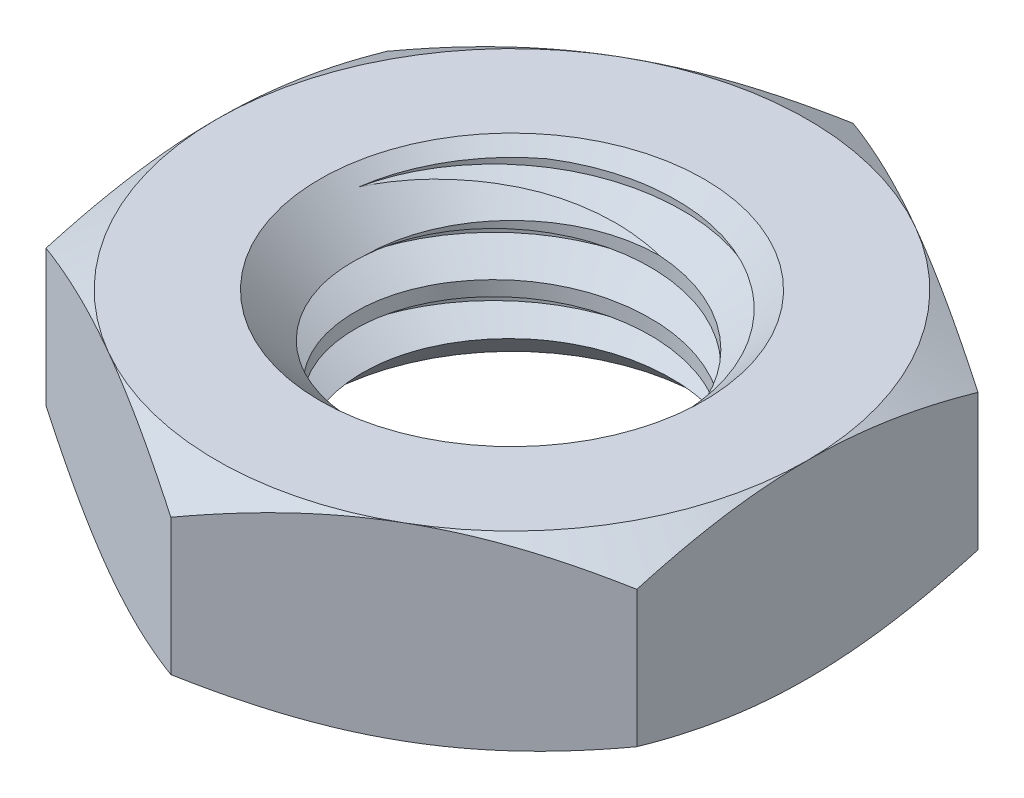
from build123d import *

# Parameters (mm, degrees)
SKETCH2_R           = 2.5
BOSS_EXTRUDE1_DEPTH = 3.2
CHAMFER1_SIZE       = 0.75
THREAD1_PITCH       = 1


with BuildPart() as part:
    # Sketch2 → Boss-Extrude1 (new body)
    with BuildSketch(Plane(origin=(0, 0, 0), x_dir=(1, 0, 0), z_dir=(0, 1, 0))):
        Polygon((5, 2.886751346), (5, -2.886751346), (0, -5.773502692), (-5, -2.886751346), (-5, 2.886751346), (0, 5.773502692), align=None)
        with Locations(Location((0, 0, 0), (0, 0, 270))):
            Circle(SKETCH2_R, mode=Mode.SUBTRACT)
    extrude(amount=BOSS_EXTRUDE1_DEPTH)

    # Sketch4 → Cut-Revolve2 (revolve, cut)
    with BuildSketch(Plane.XY):
        Polygon((-6, 2.622649731), (0, 6.086751346), (0, 7.2), (-6, 7.2), align=None)
        Polygon((-6, 0.577350269), (-6, -4), (0, -4), (0, -2.886751346), align=None)
    revolve(axis=Axis((0, 6.086751346, 0), (0, -1, 0)), mode=Mode.SUBTRACT)

    # Chamfer1
    chamfer1_edges = [part.edges().sort_by_distance(p)[0] for p in [
        (0, 0, -2.5),
        (0, 3.2, -2.5),
    ]]
    chamfer(chamfer1_edges, length=CHAMFER1_SIZE)

    # Thread1: the profile of Thread Profile1 profile screwed along a right-hand helix of 4.45 turns, 8 arcs to a turn; built about Z, then put on its axis
    thread1_z = Axis((0, 0, 0), (0, 0, 1))
    thread1_corners = [(2.4997, 0, -0.000173205), (3.041265875, 0, 0.312499999), (3.041265875, 0, 0.437499999), (2.4997, 0, 0.750173202)]
    with BuildLine(mode=Mode.PRIVATE) as thread1_profile:
        Line(thread1_corners[0], thread1_corners[1])
        Line(thread1_corners[1], thread1_corners[2])
        Line(thread1_corners[2], thread1_corners[3])
        Line(thread1_corners[3], thread1_corners[0])
    thread1_cap = Face(thread1_profile.wire())
    thread1_turn_angles = [0, 22.5, 45, 67.5, 90, 112.5, 135, 157.5, 180, 202.5, 225, 247.5, 270, 292.5, 315, 337.5, 360]
    thread1_turn_weights = [1, 0.9238795325112867, 1, 0.9238795325112867, 1, 0.9238795325112867, 1, 0.9238795325112867, 1, 0.9238795325112867, 1, 0.9238795325112867, 1, 0.9238795325112867, 1, 0.9238795325112867, 1]
    thread1_turn_rails = [Edge.make_bspline([Vector(p[0], p[1], 0).rotate(thread1_z, thread1_turn_angles[k]) / thread1_turn_weights[k] + Vector(0, 0, p[2] + THREAD1_PITCH * thread1_turn_angles[k] / 360) for k in range(17)], [0, 0, 0, 1, 1, 2, 2, 3, 3, 4, 4, 5, 5, 6, 6, 7, 7, 8, 8, 8], 2, thread1_turn_weights) for p in thread1_corners]
    thread1_turn_sides = [Face.make_surface_from_curves(thread1_turn_rails[p[0]], thread1_turn_rails[p[1]]) for p in [(0, 1), (1, 2), (2, 3), (3, 0)]]
    thread1_last_angles = [1440, 1462.5, 1485, 1507.5, 1530, 1552.5, 1575, 1588.5, 1602]
    thread1_last_weights = [1, 0.9238795325112867, 1, 0.9238795325112867, 1, 0.9238795325112867, 1, 0.9723699203976748, 1]
    thread1_last_rails = [Edge.make_bspline([Vector(p[0], p[1], 0).rotate(thread1_z, thread1_last_angles[k]) / thread1_last_weights[k] + Vector(0, 0, p[2] + THREAD1_PITCH * thread1_last_angles[k] / 360) for k in range(9)], [0, 0, 0, 1, 1, 2, 2, 3, 3, 4, 4, 4], 2, thread1_last_weights) for p in thread1_corners]
    thread1_last_sides = [Face.make_surface_from_curves(thread1_last_rails[p[0]], thread1_last_rails[p[1]]) for p in [(0, 1), (1, 2), (2, 3), (3, 0)]]
    thread1 = Plane(origin=(0, 4.45, 0), x_dir=(-1, 0, 0), z_dir=(0, -1, 0)) * Solid(Shell([*[p.moved(Location((0, 0, THREAD1_PITCH * i))) for i in range(4) for p in thread1_turn_sides], *thread1_last_sides, thread1_cap, thread1_cap.rotate(thread1_z, 1602).moved(Location((0, 0, THREAD1_PITCH * 1602 / 360)))]))
    add(thread1, mode=Mode.SUBTRACT)


solid = part.part
